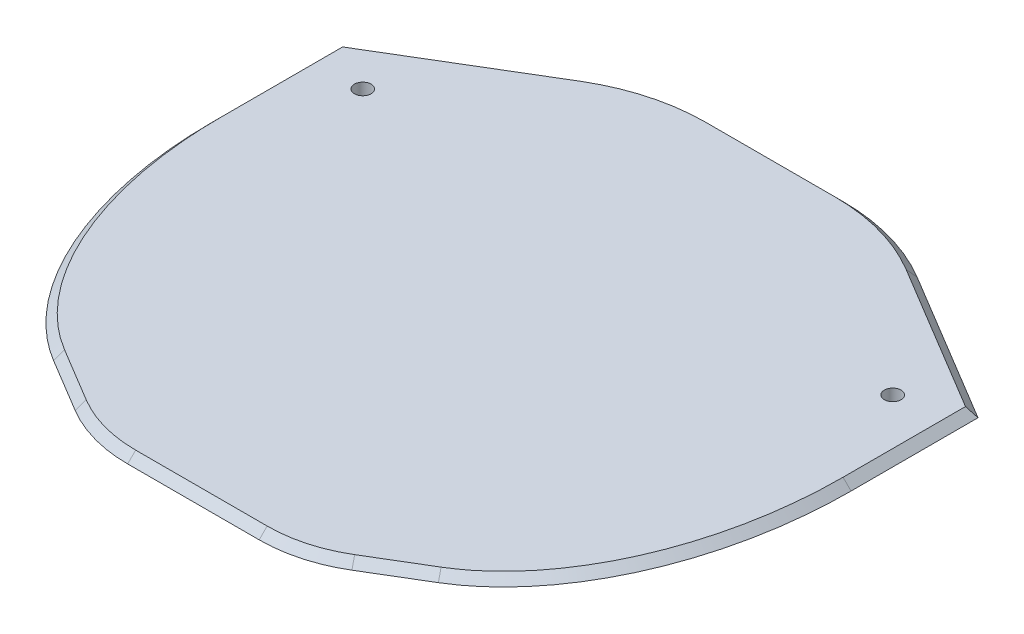
from build123d import *

# Parameters (mm, degrees)
BOSS_EXTRUDE1_DEPTH = 2.25
BOSS_EXTRUDE2_DEPTH = 2
CHAMFER1_SIZE       = 2
SKETCH2_R           = 2.1
CUT_EXTRUDE3_DEPTH  = 4.25
BOSS_EXTRUDE3_REACH = 165.691
SKETCH4_W           = 30.977136558
SKETCH4_H           = 2.25


with BuildPart() as part:
    # Sketch1 → Boss-Extrude1 (new body)
    with BuildSketch(Plane(origin=(0, 30, 0), x_dir=(1, 0, 0), z_dir=(0, 1, 0))):
        with BuildLine():
            Line((16.150801753, 24.75), (-16.150801753, 24.75))
            ThreePointArc((-16.150801753, 24.75), (-28.096079542, 23.126243037), (-39.174486808, 18.372808426))
            Line((-39.174486808, 18.372808426), (-74.75, -2.97249949))
            Line((-74.75, -2.97249949), (-74.75, -31.794317372))
            add(Edge.make_bspline(
                [(-74.75, -31.794317372), (-74.75, -34.854957393), (-74.617964132, -37.896617098), (-74.092634279, -43.942380332), (-73.699378084, -46.946489294), (-72.640258958, -52.915519667), (-71.97459072, -55.880469065), (-70.750169489, -60.295417047), (-70.303298869, -61.763844969), (-69.338133577, -64.660739638), (-68.819099262, -66.092346674), (-67.147343369, -70.334199296), (-65.881052999, -73.091977263), (-63.717003155, -77.10639512), (-62.951317542, -78.424051782), (-61.728649984, -80.366285253), (-61.307989229, -81.009022825), (-60.443810311, -82.277119387), (-60.001044485, -82.901462706), (-57.731833326, -85.972836279), (-55.741550679, -88.270936188), (-52.431333352, -91.422844474), (-51.271504838, -92.425348837), (-48.832250491, -94.308303199), (-47.564474204, -95.179986516), (-46.242530751, -95.973152587)],
                knots=[0, 0, 0, 0, 0.125, 0.125, 0.25, 0.25, 0.375, 0.375, 0.4375, 0.4375, 0.5, 0.5, 0.625, 0.625, 0.6875, 0.6875, 0.71875, 0.71875, 0.75, 0.75, 0.875, 0.875, 0.9375, 0.9375, 1, 1, 1, 1], degree=3))
            Line((-46.242530751, -95.973152587), (-31.73109903, -104.68001162))
            add(Edge.make_bspline(
                [(-31.73109903, -104.68001162), (-29.275377335, -106.153444637), (-26.68234242, -107.275661914), (-22.580548307, -108.4161221), (-21.170611667, -108.705239228), (-18.343968581, -109.085294073), (-16.920969223, -109.178932188), (-15.488568279, -109.178932188)],
                knots=[0, 0, 0, 0, 0.5, 0.5, 0.75, 0.75, 1, 1, 1, 1], degree=3))
            Line((-15.488568279, -109.178932188), (15.488568279, -109.178932188))
            add(Edge.make_bspline(
                [(15.488568279, -109.178932188), (18.352407294, -109.178932188), (21.153292414, -108.807120107), (25.257313775, -107.674700988), (26.615074004, -107.197210462), (29.234437058, -106.068808934), (30.502825354, -105.416975826), (31.73109903, -104.68001162)],
                knots=[0, 0, 0, 0, 0.5, 0.5, 0.75, 0.75, 1, 1, 1, 1], degree=3))
            Line((31.73109903, -104.68001162), (46.242530751, -95.973152587))
            add(Edge.make_bspline(
                [(46.242530751, -95.973152587), (47.567869145, -95.177949551), (48.829466075, -94.309558847), (51.243712939, -92.447684976), (52.396262721, -91.454086815), (54.604509349, -89.355684378), (55.660153085, -88.25081912), (57.177112794, -86.517159458), (57.67228307, -85.925631056), (58.63283622, -84.728723238), (59.099288908, -84.122193289), (61.366991068, -81.05182626), (62.976708922, -78.476094674), (65.141118903, -74.466347585), (65.820469131, -73.105158474), (67.100436526, -70.336783684), (67.701854467, -68.927501042), (69.388296968, -64.647487304), (70.343996758, -61.758169069), (71.964810988, -55.917525955), (72.629539561, -52.966118736), (73.690525283, -47.006016439), (74.086644723, -43.997291976), (74.484256509, -39.442260691), (74.583986383, -37.915017565), (74.716839481, -34.856005184), (74.75, -33.325606239), (74.75, -31.794317372)],
                knots=[0, 0, 0, 0, 0.0625, 0.0625, 0.125, 0.125, 0.1875, 0.1875, 0.21875, 0.21875, 0.25, 0.25, 0.375, 0.375, 0.4375, 0.4375, 0.5, 0.5, 0.625, 0.625, 0.75, 0.75, 0.875, 0.875, 0.9375, 0.9375, 1, 1, 1, 1], degree=3))
            Line((74.75, -31.794317372), (74.75, -2.97249949))
            Line((74.75, -2.97249949), (39.174486808, 18.372808426))
            ThreePointArc((39.174486808, 18.372808426), (28.096079542, 23.126243037), (16.150801753, 24.75))
        make_face()
    extrude(amount=-BOSS_EXTRUDE1_DEPTH)

    # Sketch3 → Boss-Extrude2 (add)
    with BuildSketch(Plane(origin=(0, 30, 0), x_dir=(1, 0, 0), z_dir=(0, 1, 0))):
        with BuildLine():
            Line((16.150801753, 30), (-16.150801753, 30))
            ThreePointArc((-16.150801753, 30), (-29.497480847, 28.185746411), (-41.875589524, 22.874646286))
            Line((-41.875589524, 22.874646286), (-80, 0))
            Line((-80, 0), (-80, -31.794317372))
            add(Edge.make_bspline(
                [(-80, -31.794317372), (-80, -84.256429884), (-48.190171878, -103.342326757)],
                knots=[1.570796327, 1.570796327, 1.570796327, 2.769244761, 2.769244761, 2.769244761], degree=2, weights=[1, 0.825773406, 1]))
            Line((-48.190171878, -103.342326757), (-34.658026356, -111.46161407))
            add(Edge.make_bspline(
                [(-34.658026356, -111.46161407), (-26.260716473, -116.5), (-16.467854478, -116.5)],
                knots=[6.093295641, 6.093295641, 6.093295641, 6.473074974, 6.473074974, 6.473074974], degree=2, weights=[1, 0.982025067, 1]))
            Line((-16.467854478, -116.5), (16.467854478, -116.5))
            add(Edge.make_bspline(
                [(16.467854478, -116.5), (26.260716473, -116.5), (34.658026356, -111.46161407)],
                knots=[6.093295641, 6.093295641, 6.093295641, 6.473074974, 6.473074974, 6.473074974], degree=2, weights=[1, 0.982025067, 1]))
            Line((34.658026356, -111.46161407), (48.190171878, -103.342326757))
            add(Edge.make_bspline(
                [(48.190171878, -103.342326757), (80, -84.256429884), (80, -31.794317372)],
                knots=[0.372347892, 0.372347892, 0.372347892, 1.570796327, 1.570796327, 1.570796327], degree=2, weights=[1, 0.825773406, 1]))
            Line((80, -31.794317372), (80, 0))
            Line((80, 0), (41.875589524, 22.874646286))
            ThreePointArc((41.875589524, 22.874646286), (29.497480847, 28.185746411), (16.150801753, 30))
        make_face()
    extrude(amount=BOSS_EXTRUDE2_DEPTH)

    # Chamfer1
    chamfer1_edges = [part.edges().sort_by_distance(p)[0] for p in [
        (60.937794762, 32, -11.437323143),
        (80, 32, 15.897158686),
        (71.288670322, 32, 75.11613473),
        (41.424099117, 32, 107.401970414),
        (25.908664389, 32, 115.22898027),
        (0, 32, 116.5),
        (-25.908664389, 32, 115.22898027),
        (-41.424099117, 32, 107.401970414),
        (-71.288670322, 32, 75.11613473),
        (-80, 32, 15.897158686),
        (-60.937794762, 32, -11.437323143),
        (-29.497480847, 32, -28.185746411),
        (0, 32, -30),
        (29.497480847, 32, -28.185746411),
    ]]
    chamfer(chamfer1_edges, length=CHAMFER1_SIZE - 0.0001)  # a hair under: the kernel refuses the full size

    # Sketch2 → Cut-Extrude3 (cut)
    with BuildSketch(Plane(origin=(0, 32, 0), x_dir=(1, 0, 0), z_dir=(0, 1, 0))):
        with Locations(Location((66.361535838, -7.721967193, 0), (0, 0, 270))):
            Circle(SKETCH2_R)
        with Locations(Location((-66.361535838, -7.721967193, 0), (0, 0, 270))):
            Circle(SKETCH2_R)
    extrude(amount=-CUT_EXTRUDE3_DEPTH, mode=Mode.SUBTRACT)

    # Boss-Extrude3: up to this plane
    boss_extrude3_end = Plane(origin=(0, 26.464466094, 112.964466094), z_dir=(0, -0.7071067811865458, -0.7071067811865493))
    # Sketch4 → Boss-Extrude3 (add, up to the surface)
    with BuildSketch(Plane.XY.offset(109.178932188), mode=Mode.PRIVATE) as boss_extrude3_sk1:
        with Locations((0, 28.875)):
            Rectangle(SKETCH4_W, SKETCH4_H)
    boss_extrude3_tool1 = split(extrude(boss_extrude3_sk1.sketch, amount=BOSS_EXTRUDE3_REACH, mode=Mode.PRIVATE), bisect_by=boss_extrude3_end, keep=Keep.BOTH, mode=Mode.PRIVATE)
    add(boss_extrude3_tool1.solids().sort_by_distance((0, 28.875, 109.178932))[0])


solid = part.part
